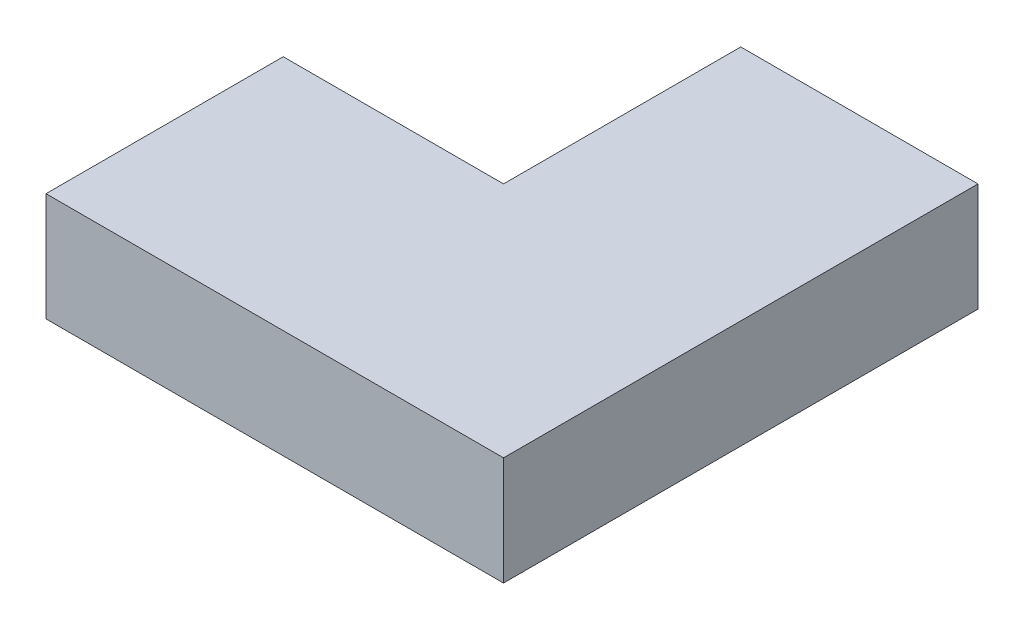
from build123d import *

# Parameters (mm, degrees)
BOSS_EXTRUDE1_DEPTH = 8
MOVE_FACE1_BY       = 23


with BuildPart() as part:
    # Sketch2 → Boss-Extrude1 (new, symmetric)
    with BuildSketch(Plane.XZ):
        Polygon((-13.796187154, 46.508213699), (-13.796187154, -23.491786301), (-48.796187154, -23.491786301), (-48.796187154, 11.508213699), (-104.296187154, 11.508213699), (-104.296187154, 46.508213699), align=None)
    extrude(amount=BOSS_EXTRUDE1_DEPTH, both=True)

    # Move Face1: a face moved inward by 23.0
    extrude(part.faces().sort_by_distance((-104.296187154, 0, 29.008213699))[0], amount=MOVE_FACE1_BY, dir=(1, 0, 0), mode=Mode.SUBTRACT)


solid = part.part
